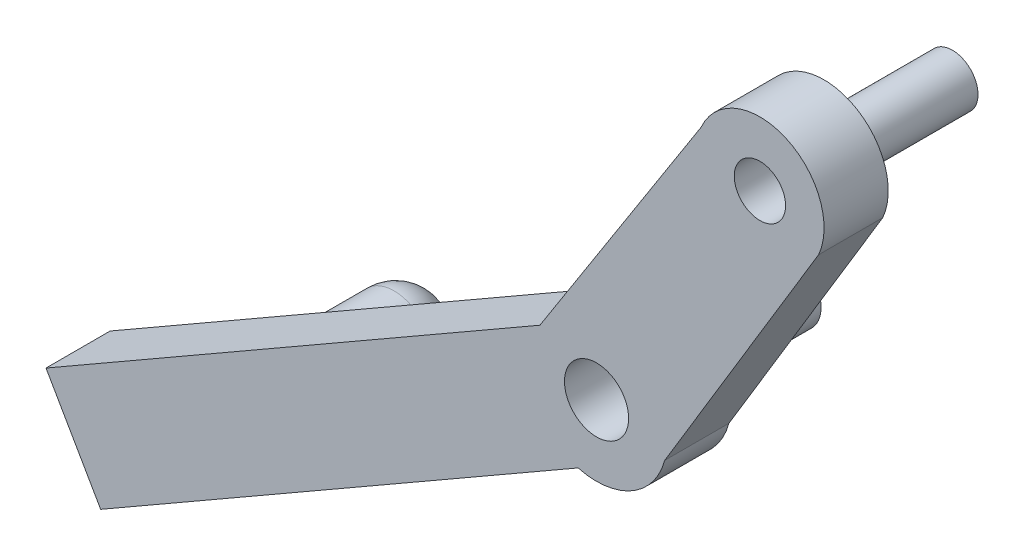
from build123d import *

# Parameters (mm, degrees)
SKETCH1_R             = 2
SKETCH1_R_2           = 2.5
BOSS_EXTRUDE1_DEPTH   = 5
SKETCH8_R             = 3
BOSS_EXTRUDE3_DEPTH   = 10
SKETCH10_R            = 2
BOSS_EXTRUDE4_DEPTH   = 10
SKETCH10_R_2          = 2.5
BOSS_EXTRUDE4_2_DEPTH = 10


with BuildPart() as part:
    # Sketch1 → Boss-Extrude1 (new body)
    with BuildSketch(Plane(origin=(0, 0, 0), x_dir=(0.4985289035363021, -0.866873077410351, 0), z_dir=(0, 0, 1))):
        with BuildLine():
            ThreePointArc((8.899126574, -3.909046337), (10.510039278, -0.019959041), (8.899126574, 3.869128256))
            Line((8.899126574, 3.869128256), (-2.35642803, 24.179978159))
            ThreePointArc((-2.35642803, 24.179978159), (-9.345167797, 25.255857552), (-10.421047189, 18.267117784))
            Line((-10.421047189, 18.267117784), (0.353553391, -2.434608777))
            Line((0.353553391, -2.434608777), (0.353553391, -46.838046337))
            Line((0.353553391, -46.838046337), (8.899126574, -46.838046337))
            Line((8.899126574, -46.838046337), (8.899126574, -3.909046337))
        make_face()
        with Locations((-6.38873761, 21.223547972)):
            Circle(SKETCH1_R, mode=Mode.SUBTRACT)
        with Locations((5.010039278, -0.019959041)):
            Circle(SKETCH1_R_2, mode=Mode.SUBTRACT)
    extrude(amount=BOSS_EXTRUDE1_DEPTH)

    # Sketch8 → Boss-Extrude3 (add)
    with BuildSketch(Plane(origin=(0, 0, 0), x_dir=(-1, 0, 0), z_dir=(0, 0, -1))):
        with Locations((25.293181008, -19.882635909)):
            Circle(SKETCH8_R)
    extrude(amount=BOSS_EXTRUDE3_DEPTH)

    # Sketch9 → Cut-Revolve1 (revolve, cut)
    with BuildSketch(Plane(origin=(2.306364199, -4.010449578, 0), x_dir=(-0.8668730774103511, -0.498528903536302, 0), z_dir=(0.498528903536302, -0.8668730774103511, 0))):
        with BuildLine():
            Line((32.838046337, 10), (34.838046337, 10))
            Line((34.838046337, 10), (34.838046337, 7))
            ThreePointArc((34.838046337, 7), (34.292209794, 8.802775638), (32.838046337, 10))
        make_face()
    revolve(axis=Axis((-25.293181008, -19.882635909, -10), (0, 0, 1)), mode=Mode.SUBTRACT)


with BuildPart() as body_2:
    # Sketch10 → Boss-Extrude4 (new body)
    with BuildSketch(Plane(origin=(0, 0, 0), x_dir=(-1, 0, 0), z_dir=(0, 0, -1))):
        with Locations((-15.213151988, 16.118776732)):
            Circle(SKETCH10_R)
    extrude(amount=BOSS_EXTRUDE4_DEPTH)


with BuildPart() as body_3:
    # Sketch10 → Boss-Extrude4 2 (new body)
    with BuildSketch(Plane(origin=(0, 0, 0), x_dir=(-1, 0, 0), z_dir=(0, 0, -1))):
        with Locations((-2.480347433, -4.353018325)):
            Circle(SKETCH10_R_2)
    extrude(amount=BOSS_EXTRUDE4_2_DEPTH)


solid = Compound([part.part, body_2.part, body_3.part])
